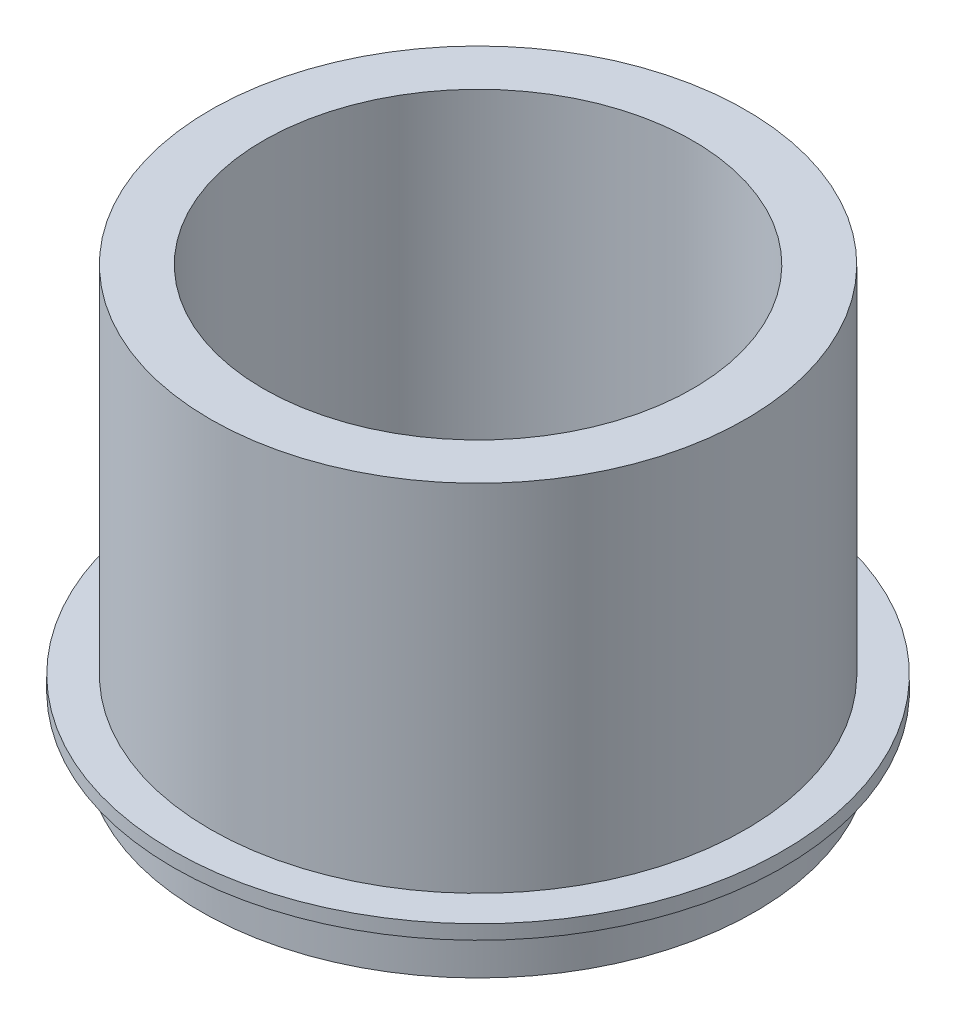
from build123d import *

# Parameters (mm, degrees)
SKETCH1_R           = 24.5745
SKETCH1_R_2         = 19.05
BOSS_EXTRUDE1_DEPTH = 4.3942
SKETCH2_R           = 23.749
SKETCH2_R_2         = 19.05
BOSS_EXTRUDE2_DEPTH = 31.496
BOSS_EXTRUDE3_START = -1.27
SKETCH15_R          = 27.051
SKETCH15_R_2        = 23.749
BOSS_EXTRUDE3_DEPTH = 1.27
BOSS_EXTRUDE4_START = 1.524
SKETCH17_R          = 24.5745
SKETCH17_R_2        = 19.685
BOSS_EXTRUDE4_DEPTH = 1.524


with BuildPart() as part:
    # Sketch1 → Boss-Extrude1 (new body)
    with BuildSketch(Plane(origin=(0, 0, 0), x_dir=(1, 0, 0), z_dir=(0, 1, 0))):
        Circle(SKETCH1_R)
        Circle(SKETCH1_R_2, mode=Mode.SUBTRACT)
    extrude(amount=BOSS_EXTRUDE1_DEPTH)

    # Sketch2 → Boss-Extrude2 (add)
    with BuildSketch(Plane(origin=(0, 4.3942, 0), x_dir=(1, 0, 0), z_dir=(0, 1, 0))):
        Circle(SKETCH2_R)
        Circle(SKETCH2_R_2, mode=Mode.SUBTRACT)
    extrude(amount=BOSS_EXTRUDE2_DEPTH)

    # Sketch15 → Boss-Extrude3 (add)
    with BuildSketch(Plane(origin=(0, 4.3942, 0), x_dir=(-1, 0, 0), z_dir=(0, 1, 0)).offset(BOSS_EXTRUDE3_START)):
        Circle(SKETCH15_R)
        Circle(SKETCH15_R_2, mode=Mode.SUBTRACT)
    extrude(amount=BOSS_EXTRUDE3_DEPTH)

    # Sketch17 → Boss-Extrude4 (add)
    with BuildSketch(Plane.XZ.offset(BOSS_EXTRUDE4_START)):
        Circle(SKETCH17_R)
        Circle(SKETCH17_R_2, mode=Mode.SUBTRACT)
    extrude(amount=-BOSS_EXTRUDE4_DEPTH)


solid = part.part
